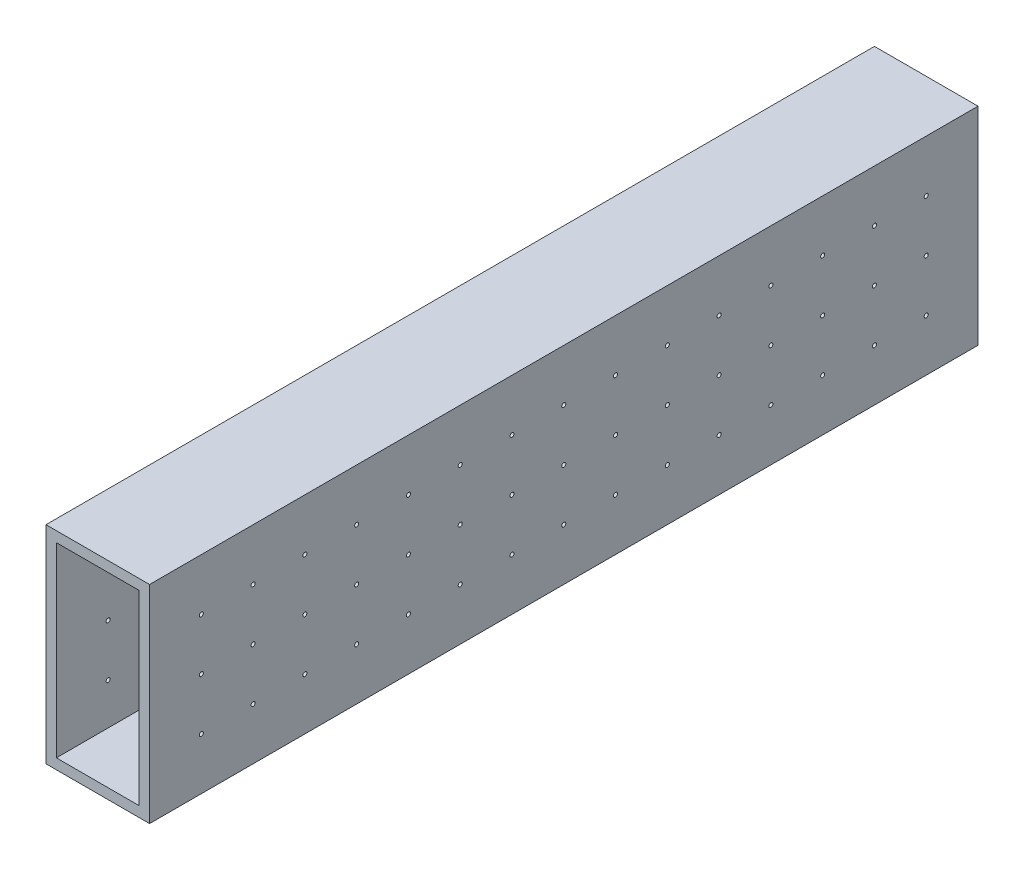
from build123d import *

# Parameters (mm, degrees)
SKETCH1_W           = 25.4
SKETCH1_H           = 50.8
SKETCH1_W_2         = 20.32
SKETCH1_H_2         = 45.72
BOSS_EXTRUDE1_DEPTH = 203.2
SKETCH2_R           = 0.5
CUT_EXTRUDE1_DEPTH  = 208.597965847


with BuildPart() as part:
    # Sketch1 → Boss-Extrude1 (new body)
    with BuildSketch(Plane.XY):
        with Locations((16.665400844, -8.681012658)):
            Rectangle(SKETCH1_W, SKETCH1_H)
        with Locations((16.665400844, -8.681012658)):
            Rectangle(SKETCH1_W_2, SKETCH1_H_2, mode=Mode.SUBTRACT)
    extrude(amount=BOSS_EXTRUDE1_DEPTH)

    # Sketch2 → Cut-Extrude1 (cut, through all)
    with BuildSketch(Plane(origin=(29.365400844, 0, 0), x_dir=(0, 0, -1), z_dir=(1, 0, 0))):
        with Locations((-190.5, 4.018987342)):
            Circle(SKETCH2_R)
        with Locations((-177.8, 4.018987342)):
            Circle(SKETCH2_R)
        with Locations((-165.1, 4.018987342)):
            Circle(SKETCH2_R)
        with Locations((-152.4, 4.018987342)):
            Circle(SKETCH2_R)
        with Locations((-139.7, 4.018987342)):
            Circle(SKETCH2_R)
        with Locations((-127, 4.018987342)):
            Circle(SKETCH2_R)
        with Locations((-114.3, 4.018987342)):
            Circle(SKETCH2_R)
        with Locations((-101.6, 4.018987342)):
            Circle(SKETCH2_R)
        with Locations((-88.9, 4.018987342)):
            Circle(SKETCH2_R)
        with Locations((-76.2, 4.018987342)):
            Circle(SKETCH2_R)
        with Locations((-63.5, 4.018987342)):
            Circle(SKETCH2_R)
        with Locations((-50.8, 4.018987342)):
            Circle(SKETCH2_R)
        with Locations((-38.1, 4.018987342)):
            Circle(SKETCH2_R)
        with Locations((-25.4, 4.018987342)):
            Circle(SKETCH2_R)
        with Locations((-12.7, 4.018987342)):
            Circle(SKETCH2_R)
        with Locations((-177.8, -8.681012658)):
            Circle(SKETCH2_R)
        with Locations((-165.1, -8.681012658)):
            Circle(SKETCH2_R)
        with Locations((-152.4, -8.681012658)):
            Circle(SKETCH2_R)
        with Locations((-139.7, -8.681012658)):
            Circle(SKETCH2_R)
        with Locations((-127, -8.681012658)):
            Circle(SKETCH2_R)
        with Locations((-114.3, -8.681012658)):
            Circle(SKETCH2_R)
        with Locations((-101.6, -8.681012658)):
            Circle(SKETCH2_R)
        with Locations((-88.9, -8.681012658)):
            Circle(SKETCH2_R)
        with Locations((-76.2, -8.681012658)):
            Circle(SKETCH2_R)
        with Locations((-63.5, -8.681012658)):
            Circle(SKETCH2_R)
        with Locations((-50.8, -8.681012658)):
            Circle(SKETCH2_R)
        with Locations((-38.1, -8.681012658)):
            Circle(SKETCH2_R)
        with Locations((-25.4, -8.681012658)):
            Circle(SKETCH2_R)
        with Locations((-12.7, -8.681012658)):
            Circle(SKETCH2_R)
        with Locations((-177.8, -21.381012658)):
            Circle(SKETCH2_R)
        with Locations((-165.1, -21.381012658)):
            Circle(SKETCH2_R)
        with Locations((-152.4, -21.381012658)):
            Circle(SKETCH2_R)
        with Locations((-139.7, -21.381012658)):
            Circle(SKETCH2_R)
        with Locations((-127, -21.381012658)):
            Circle(SKETCH2_R)
        with Locations((-114.3, -21.381012658)):
            Circle(SKETCH2_R)
        with Locations((-101.6, -21.381012658)):
            Circle(SKETCH2_R)
        with Locations((-88.9, -21.381012658)):
            Circle(SKETCH2_R)
        with Locations((-76.2, -21.381012658)):
            Circle(SKETCH2_R)
        with Locations((-63.5, -21.381012658)):
            Circle(SKETCH2_R)
        with Locations((-50.8, -21.381012658)):
            Circle(SKETCH2_R)
        with Locations((-38.1, -21.381012658)):
            Circle(SKETCH2_R)
        with Locations((-25.4, -21.381012658)):
            Circle(SKETCH2_R)
        with Locations((-12.7, -21.381012658)):
            Circle(SKETCH2_R)
        with Locations((-190.5, -8.681012658)):
            Circle(SKETCH2_R)
        with Locations((-190.5, -21.381012658)):
            Circle(SKETCH2_R)
    extrude(amount=-CUT_EXTRUDE1_DEPTH, mode=Mode.SUBTRACT)


solid = part.part
